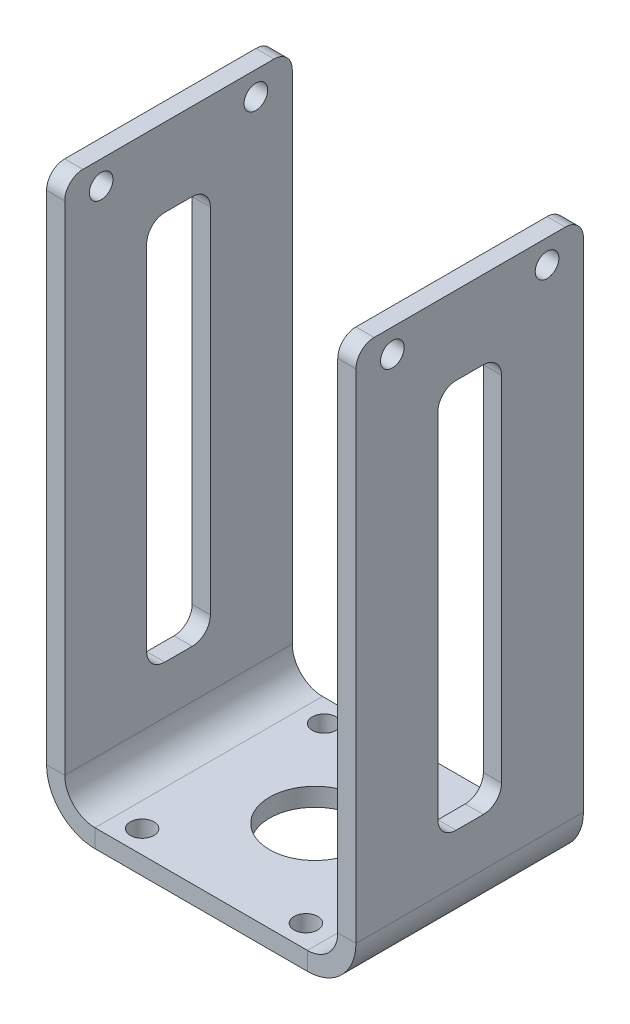
from build123d import *

# Parameters (mm, degrees)
BASE_FLANGE1_DEPTH      = 12.5
CUT_EXTRUDE2_DEPTH      = 64.602279833
CUT_EXTRUDE2_DEPTH_BACK = 64.602279833
SKETCH7_R               = 1.3
SKETCH16_R              = 5
CUT_EXTRUDE5_DEPTH      = 10
SKETCH17_R              = 1.3
CUT_EXTRUDE6_DEPTH      = 10
FILLET3_R               = 2
SKETCH18_W              = 7
SKETCH18_H              = 42.8
CUT_EXTRUDE7_DEPTH      = 71.087445381
FILLET4_R               = 2


# Sheet-metal steps are written as plain solids
with BuildPart() as part:
    # Sketch1 → Base-Flange1 (new, symmetric)
    with BuildSketch(Plane.XY):
        with BuildLine():
            Line((-15, 60), (-15, 3.33))
            ThreePointArc((-15, 3.33), (-14.024665581, 0.975334419), (-11.67, 0))
            Line((-11.67, 0), (11.67, 0))
            ThreePointArc((11.67, 0), (14.024665581, 0.975334419), (15, 3.33))
            Line((15, 3.33), (15, 60))
            Line((15, 60), (17, 60))
            Line((17, 60), (17, 3.33))
            ThreePointArc((17, 3.33), (15.438879144, -0.438879144), (11.67, -2))
            Line((11.67, -2), (-11.67, -2))
            ThreePointArc((-11.67, -2), (-15.438879144, -0.438879144), (-17, 3.33))
            Line((-17, 3.33), (-17, 60))
            Line((-17, 60), (-15, 60))
        make_face()
    extrude(amount=BASE_FLANGE1_DEPTH, both=True)

    # Sketch7 → Cut-Extrude2 (cut, two sides: drawn at the far end of the back side and taken through both)
    with BuildSketch(Plane(origin=(0, 0, 0), x_dir=(0, 0, -1), z_dir=(1, 0, 0)).offset(-CUT_EXTRUDE2_DEPTH_BACK)):
        with Locations((-8.5, 57.4)):
            Circle(SKETCH7_R)
        with Locations((8.5, 57.4)):
            Circle(SKETCH7_R)
    extrude(amount=CUT_EXTRUDE2_DEPTH + CUT_EXTRUDE2_DEPTH_BACK, mode=Mode.SUBTRACT)

    # Sketch16 → Cut-Extrude5 (cut)
    with BuildSketch(Plane.XZ.offset(2)):
        with Locations(Location((0, 0, 0), (0, 0, 270))):
            Circle(SKETCH16_R)
    extrude(amount=-CUT_EXTRUDE5_DEPTH, mode=Mode.SUBTRACT)

    # Sketch17 → Cut-Extrude6 (cut)
    with BuildSketch(Plane(origin=(0, 0, 0), x_dir=(1, 0, 0), z_dir=(0, 1, 0))):
        with Locations(Location((-9, 10, 0), (0, 0, 270))):
            Circle(SKETCH17_R)
        with Locations(Location((9, 10, 0), (0, 0, 270))):
            Circle(SKETCH17_R)
        with Locations(Location((9, -10, 0), (0, 0, 270))):
            Circle(SKETCH17_R)
        with Locations(Location((-9, -10, 0), (0, 0, 270))):
            Circle(SKETCH17_R)
    extrude(amount=-CUT_EXTRUDE6_DEPTH, mode=Mode.SUBTRACT)

    # Fillet3
    fillet3_edges = [part.edges().sort_by_distance(p)[0] for p in [
        (-16, 60, -12.5),
        (16, 60, -12.5),
        (-16, 60, 12.5),
        (16, 60, 12.5),
    ]]
    fillet(fillet3_edges, radius=FILLET3_R)

    # Sketch18 → Cut-Extrude7 (cut, through all)
    with BuildSketch(Plane.ZY.offset(17)):
        with Locations((0, 30)):
            Rectangle(SKETCH18_W, SKETCH18_H)
    extrude(amount=-CUT_EXTRUDE7_DEPTH, mode=Mode.SUBTRACT)

    # Fillet4
    fillet4_edges = [part.edges().sort_by_distance(p)[0] for p in [
        (16, 51.4, 3.5),
        (16, 8.6, 3.5),
        (16, 8.6, -3.5),
        (16, 51.4, -3.5),
        (-16, 51.4, 3.5),
        (-16, 8.6, 3.5),
        (-16, 8.6, -3.5),
        (-16, 51.4, -3.5),
    ]]
    fillet(fillet4_edges, radius=FILLET4_R)


solid = part.part
